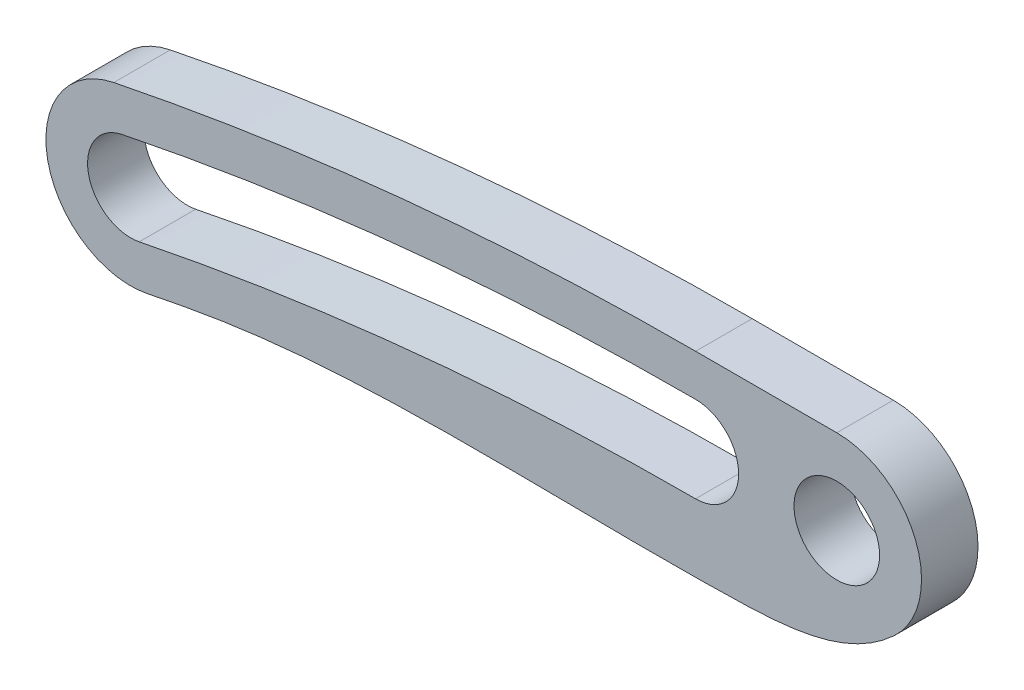
from build123d import *

# Parameters (mm, degrees)
SKETCH_2_R          = 1.515
EXTRUDE_2_DEPTH     = 2
EXTRUDE_START       = -2
EXTRUDE_3_OUTLINE_R = 1.515
EXTRUDE_3_DEPTH     = 2


with BuildPart() as part:
    # 草图2 → 凸台-拉伸2 (new body)
    with BuildSketch(Plane.XY):
        with BuildLine():
            Line((-4.501e-06, 3), (-4.996999856, 2.999992503))
            ThreePointArc((-4.996999856, 2.999992503), (-15.348887441, 2.488874451), (-25.596998621, 0.939992446))
            ThreePointArc((-25.596998621, 0.939992446), (-27.93999256, -2.596998062), (-24.403001606, -4.939991329))
            ThreePointArc((-24.403001606, -4.939991329), (-14.75186649, -3.481335038), (-5.003000142, -2.999990956))
            ThreePointArc((-5.003000143, -2.999991003), (-5.001500071, -2.999992128), (-5, -2.999994003))
            Line((-5, -2.999994003), (-3.598e-06, -3))
            ThreePointArc((-3.598e-06, -3), (3, 4.51e-07), (-4.501e-06, 3))
        make_face()
        Circle(SKETCH_2_R, mode=Mode.SUBTRACT)
        with BuildLine():
            ThreePointArc((-4.998474924, 1.524999237), (-3.475000763, -0.001525076), (-5.001525076, -1.524999237))
            ThreePointArc((-5.001525076, -1.524999237), (-14.898633731, -2.013662689), (-24.696525076, -3.494499237))
            ThreePointArc((-24.696525076, -3.494499237), (-26.494499237, -2.303474924), (-25.303474924, -0.505500763))
            ThreePointArc((-25.303474924, -0.505500763), (-15.202120074, 1.021200741), (-4.998474924, 1.524999237))
        make_face(mode=Mode.SUBTRACT)
    extrude(amount=EXTRUDE_2_DEPTH)

    # 凸台-拉伸3: read off the stored shape, not the designer's step
    # 凸台-拉伸3 outline → 凸台-拉伸3 (add)
    with BuildSketch(Plane.XY.offset(2).offset(EXTRUDE_START)):
        with BuildLine():
            ThreePointArc((-25.596998507, 0.939991888), (-27.939991888, -2.596998507), (-24.403001493, -4.939991888))
            ThreePointArc((-24.403001493, -4.939991888), (-23.740335049, -4.807830903), (-23.076763905, -4.680290004))
            add(Edge.make_bspline(
                [(2.0353099, -2.203976772), (0.364621675, -3.746809857), (-8.353685573, -4.252255019), (-16.667064883, -3.471457034), (-23.076763905, -4.680290004)],
                knots=[0, 0, 0, 0, 0.237995806, 1, 1, 1, 1], degree=3))
            ThreePointArc((2.0353099, -2.203976772), (2.79391492, 1.092721109), (-4.501e-06, 3))
            Line((-4.501e-06, 3), (-4.996999856, 2.999992413))
            ThreePointArc((-4.996999856, 2.999992413), (-15.348887454, 2.48887454), (-25.596998507, 0.939991888))
        make_face()
        with BuildLine():
            ThreePointArc((-24.696525076, -3.494499237), (-26.494499237, -2.303474924), (-25.303474924, -0.505500763))
            ThreePointArc((-25.303474924, -0.505500763), (-15.202120074, 1.021200741), (-4.998474924, 1.524999237))
            ThreePointArc((-4.998474924, 1.524999237), (-3.475000763, -0.001525076), (-5.001525076, -1.524999237))
            ThreePointArc((-5.001525076, -1.524999237), (-14.898633731, -2.013662689), (-24.696525076, -3.494499237))
        make_face(mode=Mode.SUBTRACT)
        Circle(EXTRUDE_3_OUTLINE_R, mode=Mode.SUBTRACT)
    extrude(amount=EXTRUDE_3_DEPTH)


solid = part.part
